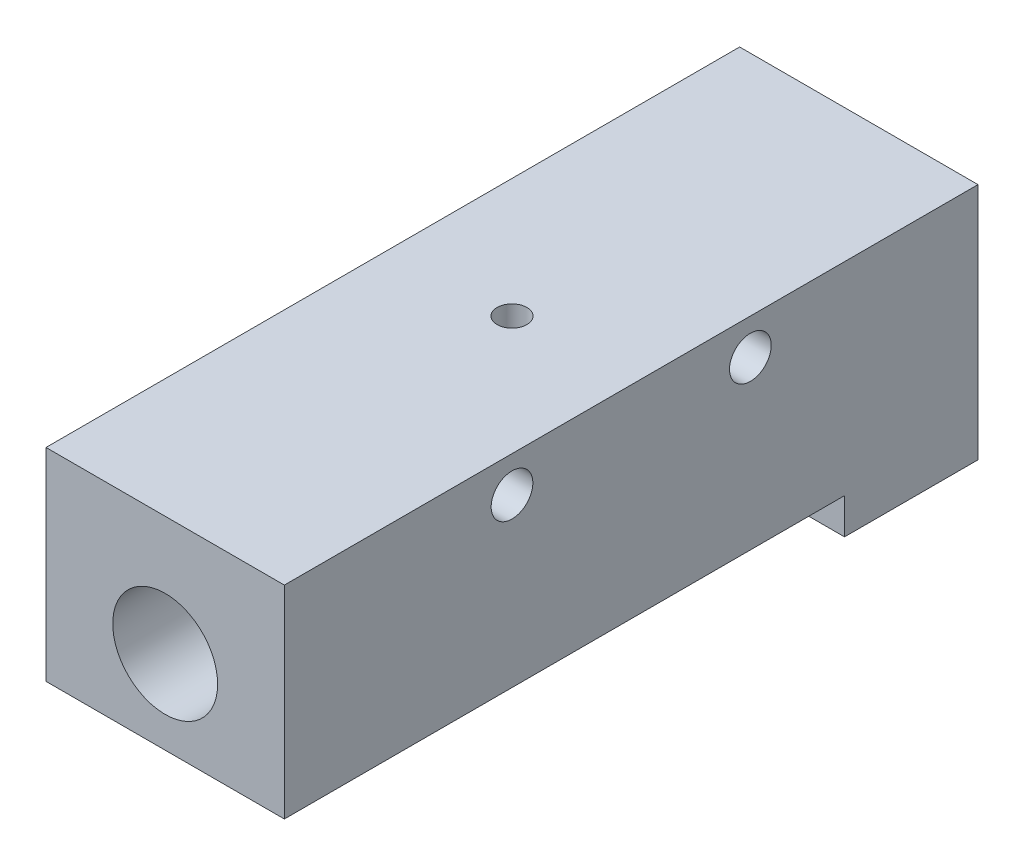
from build123d import *

# Parameters (mm, degrees)
SCHIZZO1_W                    = 20
SCHIZZO1_H                    = 20
ESTRUSIONE_ESTRUSIONE1_DEPTH  = 58.2
SCHIZZO2_R                    = 3
TAGLIO_ESTRUSIONE1_DEPTH      = 60.893572276
SCHIZZO3_R                    = 6
TAGLIO_ESTRUSIONE2_DEPTH      = 13
SCHIZZO4_R                    = 1.75
TAGLIO_ESTRUSIONE3_DEPTH      = 63.347734522
FORO_FILETTATO_G1_8_1_D       = 8.8
FORO_FILETTATO_G1_8_1_DEPTH   = 10
FORO_FILETTATO_G1_8_1_TIP     = 2.643786724
TAGLIO_ESTRUSIONE5_DEPTH      = 63.347734522
TAGLIO_ESTRUSIONE5_DEPTH_BACK = 63.347734522
FORO_FILETTATO_M3_1_D         = 2.5
FORO_FILETTATO_M3_1_DEPTH     = 5
FORO_FILETTATO_M3_1_TIP       = 0.751075774


with BuildPart() as part:
    # Schizzo1 → Estrusione-Estrusione1 (new body)
    with BuildSketch(Plane.XY):
        Rectangle(SCHIZZO1_W, SCHIZZO1_H)
    extrude(amount=-ESTRUSIONE_ESTRUSIONE1_DEPTH)

    # Schizzo2 → Taglio-Estrusione1 (cut, through all)
    with BuildSketch(Plane(origin=(0, 0, -58.2), x_dir=(-1, 0, 0), z_dir=(0, 0, -1))):
        Circle(SCHIZZO2_R)
    extrude(amount=-TAGLIO_ESTRUSIONE1_DEPTH, mode=Mode.SUBTRACT)

    # Schizzo3 → Taglio-Estrusione2 (cut)
    with BuildSketch(Plane(origin=(0, 0, -58.2), x_dir=(-1, 0, 0), z_dir=(0, 0, -1))):
        Circle(SCHIZZO3_R)
    extrude(amount=-TAGLIO_ESTRUSIONE2_DEPTH, mode=Mode.SUBTRACT)

    # Schizzo4 → Taglio-Estrusione3 (cut, through all)
    with BuildSketch(Plane(origin=(10, 0, 0), x_dir=(0, 0, -1), z_dir=(1, 0, 0))):
        with Locations((19.1, 7)):
            Circle(SCHIZZO4_R)
        with Locations((39.1, 7)):
            Circle(SCHIZZO4_R)
    extrude(amount=-TAGLIO_ESTRUSIONE3_DEPTH, mode=Mode.SUBTRACT)

    # Foro filettato G1/8-1
    with Locations(Plane.XY):
        with Locations((0, 0)):
            Hole(FORO_FILETTATO_G1_8_1_D / 2, depth=FORO_FILETTATO_G1_8_1_DEPTH)
            with Locations((0, 0, -(FORO_FILETTATO_G1_8_1_DEPTH + FORO_FILETTATO_G1_8_1_TIP / 2))):  # 118° drill point
                Cone(0, FORO_FILETTATO_G1_8_1_D / 2, FORO_FILETTATO_G1_8_1_TIP, mode=Mode.SUBTRACT)

    # Schizzo10 → Taglio-Estrusione5 (cut, two sides: drawn at the far end of the back side and taken through both)
    with BuildSketch(Plane(origin=(10, 0, 0), x_dir=(0, 0, -1), z_dir=(1, 0, 0)).offset(-TAGLIO_ESTRUSIONE5_DEPTH_BACK)):
        Polygon((-131.2640095, -7), (0, -7), (47, -7), (47, -10), (47, -141.2640095), (-110.942613081, -350.966397977), (-289.206622581, -216.702388477), align=None)
    extrude(amount=TAGLIO_ESTRUSIONE5_DEPTH + TAGLIO_ESTRUSIONE5_DEPTH_BACK, mode=Mode.SUBTRACT)

    # Foro filettato M3-1
    with Locations(Plane(origin=(0, 10, -29.1), x_dir=(1, 0, 0), z_dir=(0, 1, 0))):
        with Locations((0, 0)):
            Hole(FORO_FILETTATO_M3_1_D / 2, depth=FORO_FILETTATO_M3_1_DEPTH)
            with Locations((0, 0, -(FORO_FILETTATO_M3_1_DEPTH + FORO_FILETTATO_M3_1_TIP / 2))):  # 118° drill point
                Cone(0, FORO_FILETTATO_M3_1_D / 2, FORO_FILETTATO_M3_1_TIP, mode=Mode.SUBTRACT)


solid = part.part
